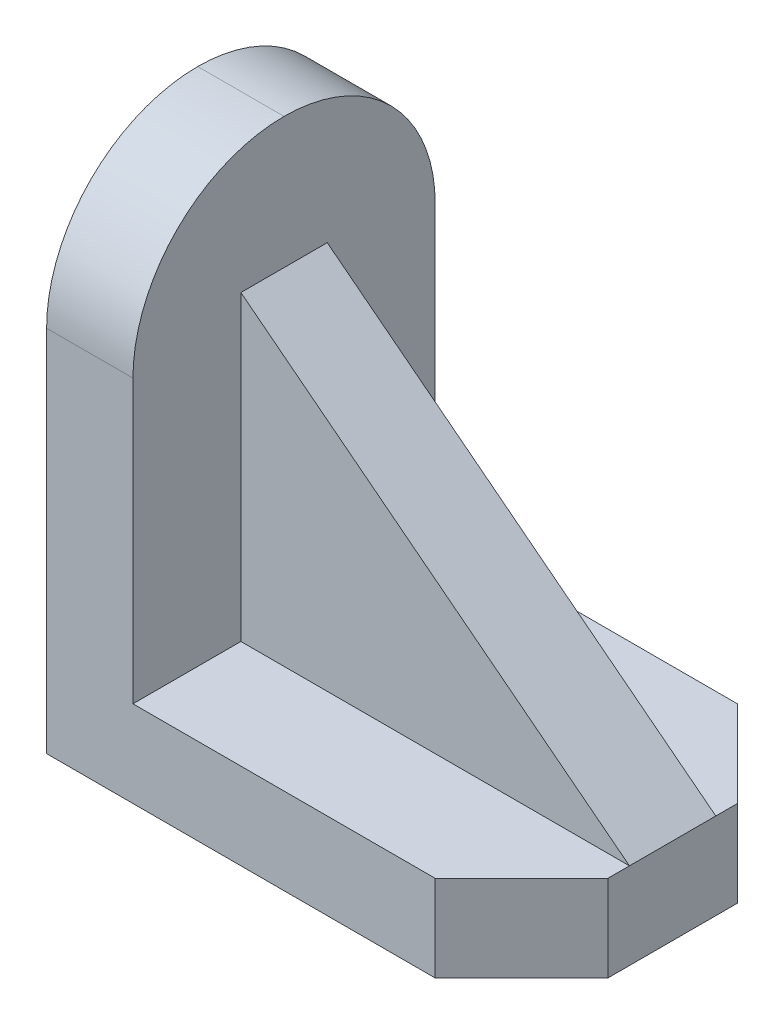
from build123d import *

# Parameters (mm, degrees)
BOSS_EXTRUDE1_DEPTH = 304.8
CHAMFER1_SIZE       = 304.8
SKETCH3_W           = 304.8
SKETCH3_H           = 1066.8
BOSS_EXTRUDE2_DEPTH = 1529.08
FILLET1_R           = 533.4
BOSS_EXTRUDE3_DEPTH = 152.4


with BuildPart() as part:
    # Sketch1 → Boss-Extrude1 (new body)
    with BuildSketch(Plane(origin=(0, 0, 0), x_dir=(1, 0, 0), z_dir=(0, 1, 0))):
        Polygon((838.2, -228.6), (533.4, -533.4), (-838.2, -533.4), (-838.2, 533.4), (838.2, 533.4), align=None)
    extrude(amount=BOSS_EXTRUDE1_DEPTH)

    # Chamfer1
    chamfer1_edges = [part.edges().sort_by_distance(p)[0] for p in [
        (838.2, 152.4, -533.4),
    ]]
    chamfer(chamfer1_edges, length=CHAMFER1_SIZE)

    # Sketch3 → Boss-Extrude2 (add)
    with BuildSketch(Plane(origin=(0, 304.8, 0), x_dir=(1, 0, 0), z_dir=(0, 1, 0))):
        with Locations((-685.8, 0)):
            Rectangle(SKETCH3_W, SKETCH3_H)
    extrude(amount=BOSS_EXTRUDE2_DEPTH)

    # Fillet1
    fillet1_edges = [part.edges().sort_by_distance(p)[0] for p in [
        (-685.8, 1833.88, -533.4),
        (-685.8, 1833.88, 533.4),
    ]]
    fillet(fillet1_edges, radius=FILLET1_R - 0.0001)  # a hair under: the kernel refuses the full size

    # Sketch4 → Boss-Extrude3 (add, symmetric)
    with BuildSketch(Plane.XY):
        Polygon((-533.4, 1371.6), (838.2, 304.8), (-533.4, 304.8), align=None)
    extrude(amount=BOSS_EXTRUDE3_DEPTH, both=True)


solid = part.part
